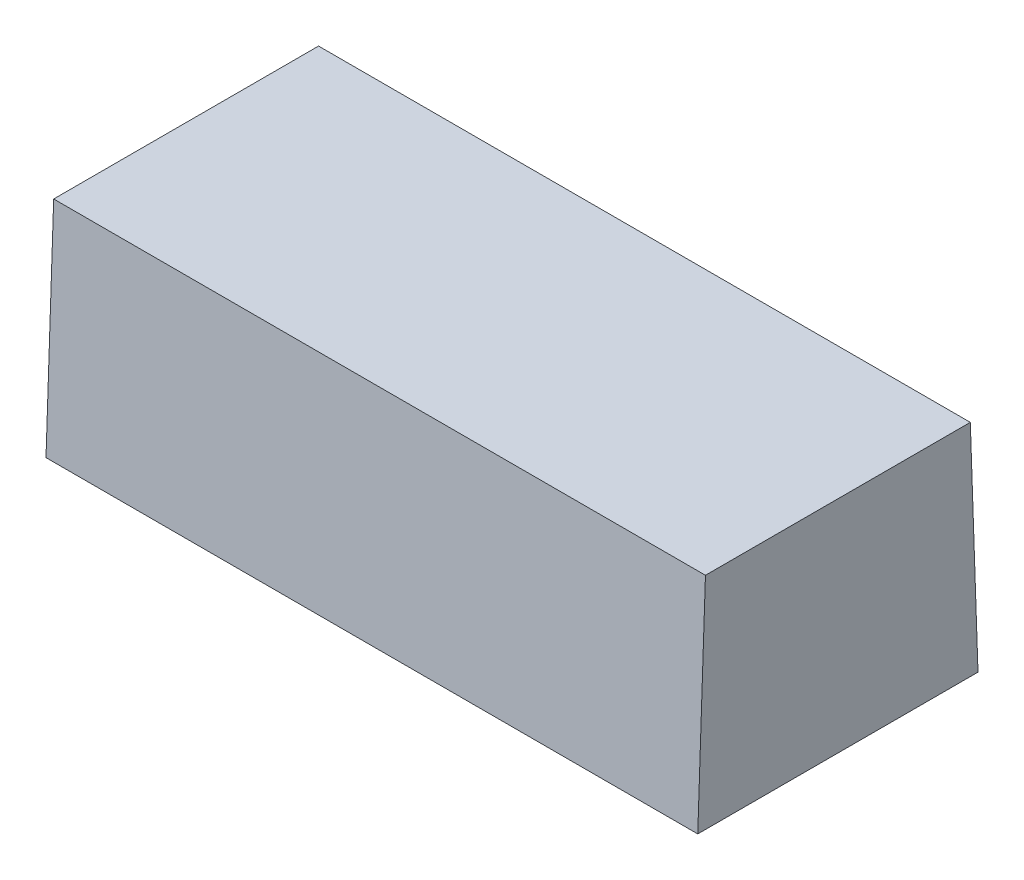
from build123d import *

# Parameters (mm, degrees)
BOSS_EXTRUDE1_DEPTH = 206.756


with BuildPart() as part:
    # Sketch1 → Boss-Extrude1 (new body)
    with BuildSketch(Plane(origin=(0, 0, 0), x_dir=(0, 0, -1), z_dir=(1, 0, 0))):
        Polygon((-44.45, -34.925), (44.45, -34.925), (42.010784251, 34.925), (-42.010784251, 34.925), align=None)
    extrude(amount=BOSS_EXTRUDE1_DEPTH)


solid = part.part
